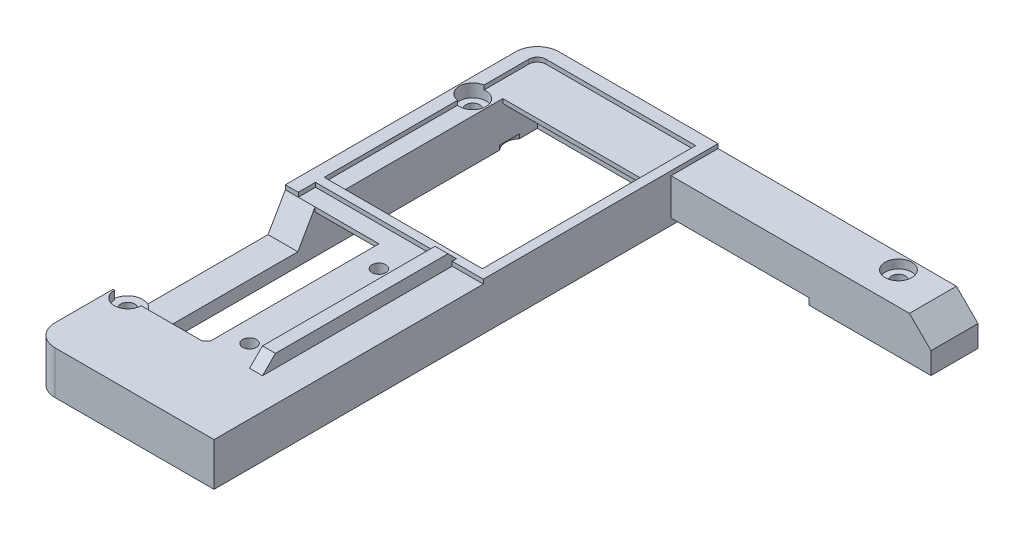
from build123d import *
from build123d.topology import SkipClean

# Parameters (mm, degrees)
SKETCH_1_W              = 337.35
SKETCH_1_H              = 116.87
SKETCH_1_W_2            = 324.05
SKETCH_1_H_2            = 103.07
EXTRUDE_1_DEPTH         = 10
FILLET_1_R              = 5
HOLE_WIZARD_3_2_3_2_1_D = 3.2
SKETCH_5_W              = 32
SKETCH_5_H              = 1.5
CUT_EXTRUDE_1_DEPTH     = 355.962566195
EXTRUDE_2_REACH         = 356.963
SKETCH_6_W              = 3
SKETCH_6_H              = 10
SKETCH_7_W              = 257.05
SKETCH_7_H              = 10
EXTRUDE_3_DEPTH         = 4
SKETCH_8_W              = 257.05
SKETCH_8_H              = 4
EXTRUDE_4_DEPTH         = 3
SKETCH_11_W             = 99.07
SKETCH_11_H             = 13
EXTRUDE_5_DEPTH         = 2
SKETCH_13_W             = 42
SKETCH_13_H             = 6.5
CUT_EXTRUDE_2_DEPTH     = 354.743782136
SKETCH_14_W             = 121.5
SKETCH_14_H             = 3.5
CUT_EXTRUDE_3_DEPTH     = 355.962566195
SKETCH_16_W             = 32
SKETCH_16_H             = 8.5
EXTRUDE_7_DEPTH         = 4
SKETCH_17_W             = 103.07
SKETCH_17_H             = 3
CUT_EXTRUDE_4_DEPTH     = 0.1
EXTRUDE_8_DEPTH         = 2
SKETCH_19_W             = 70.55
SKETCH_19_H             = 2
SKETCH_19_W_2           = 95
EXTRUDE_9_DEPTH         = 3
SKETCH_20_R             = 3.5
CUT_EXTRUDE_5_DEPTH     = 4
SKETCH_21_R             = 3.1
CUT_EXTRUDE_6_DEPTH     = 2
SKETCH_24_W             = 103.07
SKETCH_24_H             = 3
CUT_EXTRUDE_8_DEPTH     = 358.160495296
SKETCH_26_W             = 675.8738904
SKETCH_26_H             = 351.874844901
CUT_EXTRUDE_9_DEPTH     = 358.160495296
SKETCH_27_W             = 1.8
SKETCH_27_H             = 103.07
CUT_EXTRUDE_10_DEPTH    = 156.554832133
CUT_EXTRUDE_11_DEPTH    = 7
SKETCH_30_W             = 6.9
SKETCH_30_H             = 3.45
CUT_EXTRUDE_12_DEPTH    = 2
SKETCH_31_W             = 19
SKETCH_31_H             = 51.535
EXTRUDE_10_DEPTH        = 1.8
CHAMFER_2_SIZE          = 1
SKETCH_32_W             = 14.8
SKETCH_32_H             = 11.535
EXTRUDE_11_DEPTH        = 1.8
CHAMFER_1_SIZE          = 5
CHAMFER_3_SIZE          = 1
EXTRUDE_12_DEPTH        = 6.9
EXTRUDE_13_DEPTH        = 3
EXTRUDE_START           = 1
EXTRUDE_14_DEPTH        = 1
SKETCH_36_W             = 1
SKETCH_36_H             = 51.535
EXTRUDE_15_DEPTH        = 4
SKETCH_37_W             = 33.661543988
SKETCH_37_H             = 2.5
EXTRUDE_16_DEPTH        = 4
SKETCH_38_W             = 36.7
SKETCH_38_H             = 6
EXTRUDE_18_DEPTH        = 1
SKETCH_39_W             = 32.8
SKETCH_39_H             = 5.5
EXTRUDE_19_DEPTH        = 1
SKETCH_40_R             = 1.6
CUT_EXTRUDE_13_DEPTH    = 156.554832133
SKETCH_41_R             = 4.5
SKETCH_41_R_2           = 1.6
EXTRUDE_20_DEPTH        = 3
FILLET_2_R              = 4
SKETCH_42_W             = 3
SKETCH_42_H             = 46
EXTRUDE_21_DEPTH        = 3
CHAMFER_4_SIZE          = 3
SKETCH_43_W             = 2.2
SKETCH_43_H             = 52.435
EXTRUDE_22_DEPTH        = 1
SKETCH_44_W             = 38.9
SKETCH_44_H             = 2
EXTRUDE_23_DEPTH        = 1


# Some blends are built 0.0001 mm under size
with BuildPart() as part:
    # 草图1 → 凸台-拉伸1 (new body)
    with BuildSketch(Plane(origin=(0, 0, 0), x_dir=(1, 0, 0), z_dir=(0, 1, 0))):
        with Locations((168.675, 58.435)):
            Rectangle(SKETCH_1_W, SKETCH_1_H)
        with Locations((168.925, 58.435)):
            Rectangle(SKETCH_1_W_2, SKETCH_1_H_2, mode=Mode.SUBTRACT)
    extrude(amount=EXTRUDE_1_DEPTH)

    # 圆角1
    fillet_1_edges = [part.edges().sort_by_distance(p)[0] for p in [
        (0, 5, -116.87),
        (337.35, 5, -116.87),
        (337.35, 5, 0),
        (0, 5, 0),
    ]]
    fillet(fillet_1_edges, radius=FILLET_1_R)

    # Ø3.2 (3.2) 直径孔1 (through all)
    with Locations(Plane(origin=(0, 10, 0), x_dir=(1, 0, 0), z_dir=(0, 1, 0))):
        with Locations((3.45, 98.435), (87.17, 113.42), (247.17, 113.42), (334.15, 98.435), (334.15, 18.435), (247.17, 3.45), (87.17, 3.45), (3.45, 18.435)):
            Hole(HOLE_WIZARD_3_2_3_2_1_D / 2)

    # 草图5 → 切除-拉伸1 (cut, through all)
    with BuildSketch(Plane.XY.offset(-109.97)):
        with Locations((57.9, 0.75)):
            Rectangle(SKETCH_5_W, SKETCH_5_H)
    extrude(amount=-CUT_EXTRUDE_1_DEPTH, mode=Mode.SUBTRACT)

    # 草图6 → 凸台-拉伸2 (add, up to next)
    with BuildSketch(Plane.XY.offset(-109.97), mode=Mode.PRIVATE) as extrude_2_sk1:
        with Locations((40.4, 5)):
            Rectangle(SKETCH_6_W, SKETCH_6_H)
    extrude_2_tool1 = extrude(extrude_2_sk1.sketch, amount=EXTRUDE_2_REACH, mode=Mode.PRIVATE) - part.part
    add(extrude_2_tool1.solids().sort_by_distance((40.4, 5, -109.97))[0])

    # 草图7 → 凸台-拉伸3 (add)
    with BuildSketch(Plane.XY.offset(-109.97)):
        with Locations((202.425, 5)):
            Rectangle(SKETCH_7_W, SKETCH_7_H)
    extrude(amount=EXTRUDE_3_DEPTH)

    # 草图8 → 凸台-拉伸4 (add)
    with BuildSketch(Plane.XZ):
        with Locations((202.425, -107.97)):
            Rectangle(SKETCH_8_W, SKETCH_8_H)
    extrude(amount=EXTRUDE_4_DEPTH)

    # 草图11 → 凸台-拉伸5 (add)
    with BuildSketch(Plane.ZY.offset(-330.95)):
        with Locations((-56.435, 3.5)):
            Rectangle(SKETCH_11_W, SKETCH_11_H)
    extrude(amount=EXTRUDE_5_DEPTH)

    # 草图13 → 切除-拉伸2 (cut, through all)
    with BuildSketch(Plane.XY.offset(-105.97)):
        with Locations((307.95, 0.25)):
            Rectangle(SKETCH_13_W, SKETCH_13_H)
    extrude(amount=-CUT_EXTRUDE_2_DEPTH, mode=Mode.SUBTRACT)

    # 草图14 → 切除-拉伸3 (cut, through all)
    with BuildSketch(Plane(origin=(0, 0, -6.9), x_dir=(-1, 0, 0), z_dir=(0, 0, -1))):
        with Locations((-173.2, 1.75)):
            Rectangle(SKETCH_14_W, SKETCH_14_H)
    extrude(amount=-CUT_EXTRUDE_3_DEPTH, mode=Mode.SUBTRACT)

    # 草图16 → 凸台-拉伸7 (add)
    with BuildSketch(Plane.XY.offset(-109.97)):
        with Locations((57.9, 5.75)):
            Rectangle(SKETCH_16_W, SKETCH_16_H)
    extrude(amount=EXTRUDE_7_DEPTH)

    # 草图17 → 切除-拉伸4 (cut)
    with BuildSketch(Plane(origin=(330.95, 0, 0), x_dir=(0, 0, -1), z_dir=(1, 0, 0))):
        with Locations((58.435, -1.5)):
            Rectangle(SKETCH_17_W, SKETCH_17_H)
    extrude(amount=-CUT_EXTRUDE_4_DEPTH, mode=Mode.SUBTRACT)

    # 草图18 → 凸台-拉伸8 (add)
    with BuildSketch(Plane(origin=(0, 0, -6.9), x_dir=(-1, 0, 0), z_dir=(0, 0, -1))):
        Polygon((-233.95, 0), (-233.95, 3.5), (-112.45, 3.5), (-112.45, 0), (-41.9, 0), (-41.9, 10), (-328.95, 10), (-328.95, 0), align=None)
    extrude(amount=EXTRUDE_8_DEPTH)

    # 草图19 → 凸台-拉伸9 (add)
    with BuildSketch(Plane.XZ):
        with Locations((77.175, -7.9)):
            Rectangle(SKETCH_19_W, SKETCH_19_H)
        with Locations((281.45, -7.9)):
            Rectangle(SKETCH_19_W_2, SKETCH_19_H)
    extrude(amount=EXTRUDE_9_DEPTH)

    # 草图20 → 切除-拉伸5 (cut)
    with BuildSketch(Plane.XZ.offset(3)):
        with Locations((92.088456012, -9.54)):
            Circle(SKETCH_20_R)
        with Locations((262.268456012, -9.54)):
            Circle(SKETCH_20_R)
        with Locations((328.308456012, -13.35)):
            Circle(SKETCH_20_R)
        with Locations((328.308456012, -74.31)):
            Circle(SKETCH_20_R)
        with Locations((137.808456012, -107.33)):
            Circle(SKETCH_20_R)
        with Locations((22.238456012, -9.54)):
            Circle(SKETCH_20_R)
        with Locations((9.538456012, -23.51)):
            Circle(SKETCH_20_R)
        with Locations((9.538456012, -103.52)):
            Circle(SKETCH_20_R)
    extrude(amount=-CUT_EXTRUDE_5_DEPTH, mode=Mode.SUBTRACT)

    # 草图21 → 切除-拉伸6 (cut)
    with BuildSketch(Plane(origin=(0, 10, 0), x_dir=(1, 0, 0), z_dir=(0, 1, 0))):
        with Locations(Location((87.17, 113.42, 0), (0, 0, 270))):
            Circle(SKETCH_21_R)
        with Locations(Location((247.17, 113.42, 0), (0, 0, 270))):
            Circle(SKETCH_21_R)
        with Locations(Location((334.15, 98.435, 0), (0, 0, 270))):
            Circle(SKETCH_21_R)
        with Locations(Location((334.15, 18.435, 0), (0, 0, 270))):
            Circle(SKETCH_21_R)
        with Locations(Location((247.17, 3.45, 0), (0, 0, 270))):
            Circle(SKETCH_21_R)
        with Locations(Location((87.17, 3.45, 0), (0, 0, 270))):
            Circle(SKETCH_21_R)
        with Locations(Location((3.45, 18.435, 0), (0, 0, 270))):
            Circle(SKETCH_21_R)
        with Locations(Location((3.45, 98.435, 0), (0, 0, 270))):
            Circle(SKETCH_21_R)
    extrude(amount=-CUT_EXTRUDE_6_DEPTH, mode=Mode.SUBTRACT)

    # 草图24 → 切除-拉伸8 (cut, through all)
    with BuildSketch(Plane(origin=(337.35, 0, 0), x_dir=(0, 0, -1), z_dir=(1, 0, 0))):
        with Locations((58.435, -1.5)):
            Rectangle(SKETCH_24_W, SKETCH_24_H)
    extrude(amount=-CUT_EXTRUDE_8_DEPTH, mode=Mode.SUBTRACT)

    # 草图26 → 切除-拉伸9 (cut, through all)
    with BuildSketch(Plane(origin=(0, 10, 0), x_dir=(1, 0, 0), z_dir=(0, 1, 0))):
        with Locations((186.884533427, 86.899688896)):
            Rectangle(SKETCH_26_W, SKETCH_26_H)
        Polygon((0, 116.87), (102.17, 116.87), (102.17, 8.9), (41.9, 8.9), (41.9, 0), (0, 0), align=None, mode=Mode.SUBTRACT)
    extrude(amount=-CUT_EXTRUDE_9_DEPTH, mode=Mode.SUBTRACT)

    # 草图27 → 切除-拉伸10 (cut, through all)
    with BuildSketch(Plane(origin=(0, 10, 0), x_dir=(1, 0, 0), z_dir=(0, 1, 0))):
        with Locations((39.8, 58.435)):
            Rectangle(SKETCH_27_W, SKETCH_27_H)
    extrude(amount=-CUT_EXTRUDE_10_DEPTH, mode=Mode.SUBTRACT)

    # 草图28 → 切除-拉伸11 (cut)
    with BuildSketch(Plane(origin=(0, 10, 0), x_dir=(1, 0, 0), z_dir=(0, 1, 0))):
        with BuildLine():
            Line((0, 58.435), (6.9, 58.435))
            Line((6.9, 58.435), (6.9, 18.435))
            ThreePointArc((6.9, 18.435), (3.45, 21.885), (0, 18.435))
            Line((0, 18.435), (0, 58.435))
        make_face()
    extrude(amount=-CUT_EXTRUDE_11_DEPTH, mode=Mode.SUBTRACT)

    # 草图30 → 切除-拉伸12 (cut)
    with BuildSketch(Plane(origin=(0, 8, 0), x_dir=(1, 0, 0), z_dir=(0, 1, 0))):
        with Locations((3.45, 20.16)):
            Rectangle(SKETCH_30_W, SKETCH_30_H)
    extrude(amount=CUT_EXTRUDE_12_DEPTH, mode=Mode.SUBTRACT)

    # 草图31 → 凸台-拉伸10 (add)
    with BuildSketch(Plane(origin=(0, 10, 0), x_dir=(1, 0, 0), z_dir=(0, 1, 0))):
        with Locations((31.2, 32.6675)):
            Rectangle(SKETCH_31_W, SKETCH_31_H)
    extrude(amount=-EXTRUDE_10_DEPTH)

    # 倒角2
    chamfer_2_edges = [part.edges().sort_by_distance(p)[0] for p in [
        (40.7, 9.1, -58.435),
    ]]
    chamfer(chamfer_2_edges, length=CHAMFER_2_SIZE)

    # 草图32 → 凸台-拉伸11 (add)
    with BuildSketch(Plane(origin=(0, 10, 0), x_dir=(1, 0, 0), z_dir=(0, 1, 0))):
        with Locations((14.3, 12.6675)):
            Rectangle(SKETCH_32_W, SKETCH_32_H)
    extrude(amount=-EXTRUDE_11_DEPTH)

    # 倒角1
    chamfer_1_edges = [part.edges().sort_by_distance(p)[0] for p in [
        (102.17, 10, -111.42),
    ]]
    chamfer(chamfer_1_edges, length=CHAMFER_1_SIZE)

    # 倒角3
    chamfer_3_edges = [part.edges().sort_by_distance(p)[0] for p in [
        (21.7, 9.1, -18.435),
    ]]
    chamfer(chamfer_3_edges, length=CHAMFER_3_SIZE)

    # 草图33 → 凸台-拉伸12 (add)
    with BuildSketch(Plane.ZY):
        Polygon((-58.435, 10), (-54.435, 3), (-58.435, 3), align=None)
    extrude(amount=-EXTRUDE_12_DEPTH)

    # 草图34 → 凸台-拉伸13 (add)
    with BuildSketch(Plane.XZ.offset(-8.2)):
        Polygon((21.528427125, -16.435), (6.9, -16.435), (6.9, -18.435), (20.7, -18.435), (21.7, -19.435), (21.7, -58.435), (23.7, -58.435), (23.7, -18.606572875), align=None)
    extrude(amount=EXTRUDE_13_DEPTH)

    # 草图35 → 凸台-拉伸14 (add)
    with SkipClean():  # the faces are left unmerged after this step: merging them gives an invalid solid
        with BuildSketch(Plane(origin=(0, 10, 0), x_dir=(1, 0, 0), z_dir=(0, 1, 0)).offset(EXTRUDE_START)):
            with BuildLine():
                ThreePointArc((5, 116.87), (1.464466094, 115.405533906), (0, 111.87))
                Line((0, 111.87), (0, 58.435))
                Line((0, 58.435), (3, 58.435))
                Line((3, 58.435), (3, 95.367835185))
                ThreePointArc((3, 95.367835185), (0.35, 98.435), (3, 101.502164815))
                Line((3, 101.502164815), (3, 111.87))
                ThreePointArc((3, 111.87), (3.585786438, 113.284213562), (5, 113.87))
                Line((5, 113.87), (41.9, 113.87))
                Line((41.9, 113.87), (41.9, 116.87))
                Line((41.9, 116.87), (5, 116.87))
            make_face()
        extrude(amount=-EXTRUDE_14_DEPTH)

    # 草图36 → 凸台-拉伸15 (add)
    with BuildSketch(Plane(origin=(0, 10, 0), x_dir=(1, 0, 0), z_dir=(0, 1, 0))):
        with Locations((40.2, 84.2025)):
            Rectangle(SKETCH_36_W, SKETCH_36_H)
    extrude(amount=-EXTRUDE_15_DEPTH)

    # 草图37 → 凸台-拉伸16 (add)
    with SkipClean():  # the faces are left unmerged after this step: merging them gives an invalid solid
        with BuildSketch(Plane.XZ.offset(-6)):
            with Locations((22.869228006, -108.72)):
                Rectangle(SKETCH_37_W, SKETCH_37_H)
        extrude(amount=-EXTRUDE_16_DEPTH)

    # 草图38 → 凸台-拉伸18 (add)
    with BuildSketch(Plane(origin=(0, 10, 0), x_dir=(1, 0, 0), z_dir=(0, 1, 0))):
        with Locations((21.35, 61.435)):
            Rectangle(SKETCH_38_W, SKETCH_38_H)
    extrude(amount=-EXTRUDE_18_DEPTH)

    # 草图39 → 凸台-拉伸19 (add)
    with SkipClean():  # the faces are left unmerged after this step: merging them gives an invalid solid
        with BuildSketch(Plane(origin=(0, 10, 0), x_dir=(1, 0, 0), z_dir=(0, 1, 0))):
            with Locations((23.3, 104.72)):
                Rectangle(SKETCH_39_W, SKETCH_39_H)
        extrude(amount=-EXTRUDE_19_DEPTH)

    # 草图40 → 切除-拉伸13 (cut, through all)
    with SkipClean():  # the faces are left unmerged after this step: merging them gives an invalid solid
        with BuildSketch(Plane(origin=(0, 10, 0), x_dir=(1, 0, 0), z_dir=(0, 1, 0))):
            with Locations(Location((26.7, 53.435, 0), (0, 0, 270))):
                Circle(SKETCH_40_R)
            with Locations(Location((26.7, 23.435, 0), (0, 0, 270))):
                Circle(SKETCH_40_R)
        extrude(amount=-CUT_EXTRUDE_13_DEPTH, mode=Mode.SUBTRACT)

    # 草图41 → 凸台-拉伸20 (add)
    # profile 1 of 2: a face of its own
    with SkipClean():  # the faces are left unmerged after this step: merging them gives an invalid solid
        with BuildSketch(Plane.XZ.offset(-8.2)):
            with Locations((26.7, -23.435)):
                Circle(SKETCH_41_R)
            with Locations(Location((26.7, -23.435, 0), (0, 0, 270))):
                Circle(SKETCH_41_R_2, mode=Mode.SUBTRACT)
        # profile 2 of 2: a face of its own
        with BuildSketch(Plane.XZ.offset(-8.2)):
            with Locations((26.7, -53.435)):
                Circle(SKETCH_41_R)
            with Locations(Location((26.7, -53.435, 0), (0, 0, 90))):
                Circle(SKETCH_41_R_2, mode=Mode.SUBTRACT)
        extrude(amount=EXTRUDE_20_DEPTH)

    # 圆角2
    # the kernel refuses this fillet: 4 mm, written as the material it adds along each edge
    with BuildSketch(Plane(origin=(23.7, 5.2, -56.789101966), x_dir=(0, 0, -1), z_dir=(0, 1, 0))) as fillet_2_piece_1:
        with BuildLine():
            CenterArc((5.090717348, -2.033032191), FILLET_2_R, 149.452131315, 37.080030589)
            Line((1.11668473, -2.488075866), (1.037204077, -2.497176739))
            ThreePointArc((1.037204077, -2.497176739), (0.678377965, -1.190164205), (-0.059628479, -0.053333333))
            Line((-0.059628479, -0.053333333), (0, 0.08))
            ThreePointArc((0, 0.08), (0.822949017, 0.08), (1.577001647, 0.040660644))
            Line((1.577001647, 0.040660644), (1.645898034, 0))
        make_face()
    extrude(amount=3)
    with BuildSketch(Plane(origin=(23.7, 5.2, -50.080898034), x_dir=(0, 0, 1), z_dir=(0, 1, 0))) as fillet_2_piece_2:
        with BuildLine():
            CenterArc((5.086869542, 4), FILLET_2_R, 186.756327031, 83.243672969)
            Line((1.114647656, 3.529411765), (1.035203218, 3.52))
            ThreePointArc((1.035203218, 3.52), (0.860700296, 1.668894486), (-0.059628479, 0.053333333))
            Line((-0.059628479, 0.053333333), (0, -0.08))
            Line((0, -0.08), (5.086869542, -0.08))
            Line((5.086869542, -0.08), (5.086869542, 0))
        make_face()
    extrude(amount=3)
    with BuildSketch(Plane(origin=(23.7, 5.2, -26.789101966), x_dir=(0, 0, -1), z_dir=(0, 1, 0))) as fillet_2_piece_3:
        with BuildLine():
            CenterArc((5.086869542, -4), FILLET_2_R, 90, 83.243672969)
            Line((1.114647656, -3.529411765), (1.035203218, -3.52))
            ThreePointArc((1.035203218, -3.52), (0.860700296, -1.668894486), (-0.059628479, -0.053333333))
            Line((-0.059628479, -0.053333333), (0, 0.08))
            Line((0, 0.08), (5.086869542, 0.08))
            Line((5.086869542, 0.08), (5.086869542, 0))
        make_face()
    extrude(amount=3)
    with BuildSketch(Plane(origin=(23.7, 5.2, -20.080898034), x_dir=(0, 0, 1), z_dir=(0, 1, 0))) as fillet_2_piece_4:
        with BuildLine():
            CenterArc((5.057563246, 1.777752742), FILLET_2_R, 171.732563224, 34.654836408)
            Line((1.099132558, 2.352927922), (1.019963944, 2.364431426))
            ThreePointArc((1.019963944, 2.364431426), (0.65051009, 1.129309678), (-0.059628479, 0.053333333))
            Line((-0.059628479, 0.053333333), (0, -0.08))
            ThreePointArc((0, -0.08), (0.737162579, -0.08), (1.402660397, -0.035555055))
            Line((1.402660397, -0.035555055), (1.474325158, 0))
        make_face()
    extrude(amount=3)

    # 草图42 → 凸台-拉伸21 (add)
    with BuildSketch(Plane(origin=(0, 10, 0), x_dir=(1, 0, 0), z_dir=(0, 1, 0))):
        with Locations((33.2, 41.435)):
            Rectangle(SKETCH_42_W, SKETCH_42_H)
    extrude(amount=EXTRUDE_21_DEPTH)

    # 倒角4
    chamfer_4_edges = [part.edges().sort_by_distance(p)[0] for p in [
        (33.2, 13, -18.435),
        (33.2, 13, -64.435),
    ]]
    chamfer(chamfer_4_edges, length=CHAMFER_4_SIZE - 0.0001)  # a hair under: the kernel refuses the full size

    # 草图43 → 凸台-拉伸22 (add)
    with BuildSketch(Plane(origin=(0, 10, 0), x_dir=(1, 0, 0), z_dir=(0, 1, 0))):
        with Locations((40.8, 90.6525)):
            Rectangle(SKETCH_43_W, SKETCH_43_H)
    extrude(amount=EXTRUDE_22_DEPTH)

    # 草图44 → 凸台-拉伸23 (add)
    with BuildSketch(Plane(origin=(0, 10, 0), x_dir=(1, 0, 0), z_dir=(0, 1, 0))):
        with Locations((22.45, 63.435)):
            Rectangle(SKETCH_44_W, SKETCH_44_H)
    extrude(amount=EXTRUDE_23_DEPTH)


solid = part.part
